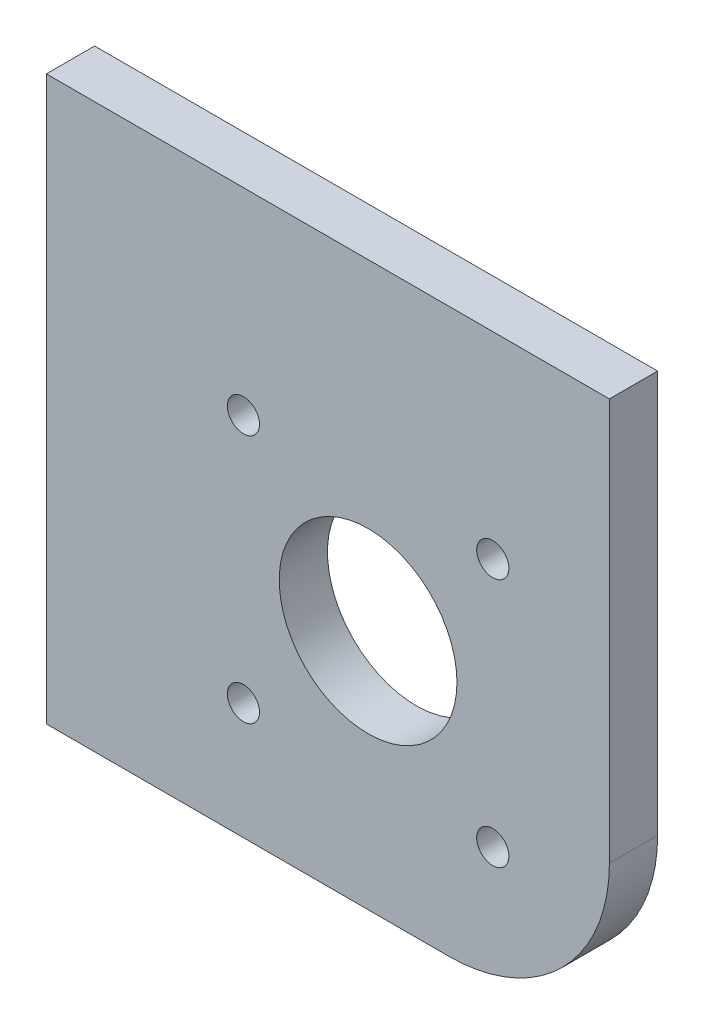
from build123d import *

# Parameters (mm, degrees)
EXTRUDE_1_DEPTH     = 6
SKETCH_2_R          = 11.05
SKETCH_2_R_2        = 2
CUT_EXTRUDE_1_DEPTH = 372.747257782


with BuildPart() as part:
    # Эскиз1 → Бобышка-Вытянуть1 (new body)
    with BuildSketch(Plane.XY):
        with BuildLine():
            Line((6, -293.846153846), (6, -363.846153846))
            Line((6, -363.846153846), (56, -363.846153846))
            ThreePointArc((56, -363.846153846), (70.142135624, -357.98828947), (76, -343.846153846))
            Line((76, -343.846153846), (76, -293.846153846))
            Line((76, -293.846153846), (6, -293.846153846))
        make_face()
    extrude(amount=-EXTRUDE_1_DEPTH)

    # Эскиз2 → Вырез-Вытянуть1 (cut, through all)
    with BuildSketch(Plane.XY):
        with Locations((46, -333.846153846)):
            Circle(SKETCH_2_R)
        with Locations((61.5, -349.346153846)):
            Circle(SKETCH_2_R_2)
        with Locations((30.5, -349.346153846)):
            Circle(SKETCH_2_R_2)
        with Locations((30.5, -318.346153846)):
            Circle(SKETCH_2_R_2)
        with Locations((61.5, -318.346153846)):
            Circle(SKETCH_2_R_2)
    extrude(amount=-CUT_EXTRUDE_1_DEPTH, mode=Mode.SUBTRACT)


solid = part.part
